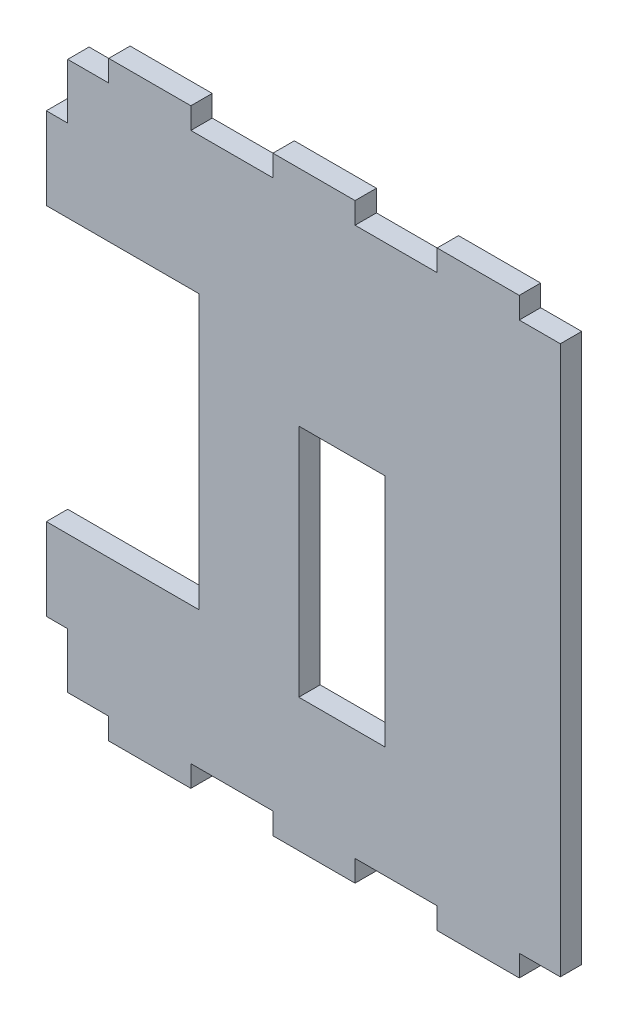
from build123d import *

# Parameters (mm, degrees)
SKETCH1_W           = 114.3
SKETCH1_H           = 127.2286
BOSS_EXTRUDE1_DEPTH = 2.48046875
SKETCH3_W           = 19.05
SKETCH3_H           = 4.9609375
BOSS_EXTRUDE2_DEPTH = 4.9609375
SKETCH5_W           = 19.05
SKETCH5_H           = 4.9609375
BOSS_EXTRUDE3_DEPTH = 4.9784
SKETCH7_W           = 4.9609375
SKETCH7_H           = 63.5
CUT_EXTRUDE1_DEPTH  = 30.48
SKETCH6_W           = 4.9609375
SKETCH6_H           = 19.05
BOSS_EXTRUDE4_DEPTH = 4.9609375
CAVITY1_START       = -3.0309375
CAVITY1_2_OUTLINE_W = 41
CAVITY1_2_OUTLINE_H = 4.9609375
CAVITY1_2_DEPTH     = 19
CAVITY1_START_2     = -2.3309375
CAVITY1_3_DEPTH     = 17.6
CAVITY1_START_3     = -3
CAVITY1_4_DEPTH     = 6
CAVITY1_START_4     = 0.91953125
CAVITY1_6_OUTLINE_R = 3
CAVITY1_6_DEPTH     = 1.5609375
SKETCH9_W           = 20
SKETCH9_H           = 54.483
CUT_EXTRUDE2_DEPTH  = 93.827315363


with BuildPart() as part:
    # Sketch1 → Boss-Extrude1 (new, symmetric)
    with BuildSketch(Plane.XY):
        Rectangle(SKETCH1_W, SKETCH1_H)
    extrude(amount=BOSS_EXTRUDE1_DEPTH, both=True)

    # Sketch3 → Boss-Extrude2 (add)
    with BuildSketch(Plane(origin=(0, 63.6143, 0), x_dir=(1, 0, 0), z_dir=(0, 1, 0))):
        with Locations((38.1, 0)):
            Rectangle(SKETCH3_W, SKETCH3_H)
        Rectangle(SKETCH3_W, SKETCH3_H)
        with Locations((-38.1, 0)):
            Rectangle(SKETCH3_W, SKETCH3_H)
    extrude(amount=BOSS_EXTRUDE2_DEPTH)

    # Sketch5 → Boss-Extrude3 (add)
    with BuildSketch(Plane.XZ.offset(63.6143)):
        Rectangle(SKETCH5_W, SKETCH5_H)
        with Locations((38.1, 0)):
            Rectangle(SKETCH5_W, SKETCH5_H)
        with Locations((-38.1, 0)):
            Rectangle(SKETCH5_W, SKETCH5_H)
    extrude(amount=BOSS_EXTRUDE3_DEPTH)

    # Sketch7 → Cut-Extrude1 (cut)
    with BuildSketch(Plane.ZY.offset(57.15)):
        Rectangle(SKETCH7_W, SKETCH7_H)
    extrude(amount=-CUT_EXTRUDE1_DEPTH, mode=Mode.SUBTRACT)

    # Sketch6 → Boss-Extrude4 (add)
    with BuildSketch(Plane.ZY.offset(57.15)):
        with Locations((0, 41.275)):
            Rectangle(SKETCH6_W, SKETCH6_H)
        with Locations((0, -41.275)):
            Rectangle(SKETCH6_W, SKETCH6_H)
    extrude(amount=BOSS_EXTRUDE4_DEPTH)

    # Cavity1: read off the stored shape, not the designer's step
    # Cavity1 outline → Cavity1 (revolve, cut)
    with BuildSketch(Plane(origin=(15.2690625, 0, -2.53046875), x_dir=(1, 0, 0), z_dir=(0, 0, 1))):
        with BuildLine():
            ThreePointArc((0.05, -31.0547625), (0.064644661, -31.019407161), (0.1, -31.0047625))
            Line((0.1, -31.0047625), (0.1, 9.9952375))
            ThreePointArc((0.1, 9.9952375), (0.064644661, 10.009882161), (0.05, 10.0452375))
            Line((0.05, 10.0452375), (0.05, -31.0547625))
        make_face()
    revolve(axis=Axis((15.2690625, 0, -2.53046875), (0, 1, 0)), mode=Mode.SUBTRACT)

    # Cavity1 2 outline → Cavity1 2 (cut)
    with BuildSketch(Plane.YZ.offset(CAVITY1_START)):
        with Locations((-10.5047625, 0)):
            Rectangle(CAVITY1_2_OUTLINE_W, CAVITY1_2_OUTLINE_H)
    extrude(amount=CAVITY1_2_DEPTH, mode=Mode.SUBTRACT)

    # Cavity1 3 outline → Cavity1 3 (cut)
    with BuildSketch(Plane.YZ.offset(CAVITY1_START_2)):
        with BuildLine():
            ThreePointArc((-31.0047625, -2.43046875), (-31.019407161, -2.465824089), (-31.0547625, -2.48046875))
            Line((-31.0547625, -2.48046875), (-31.0047625, -2.48046875))
            Line((-31.0047625, -2.48046875), (-31.0047625, -2.43046875))
        make_face()
        with BuildLine():
            Line((9.9952375, -2.43046875), (9.9952375, -2.48046875))
            Line((9.9952375, -2.48046875), (10.0452375, -2.48046875))
            ThreePointArc((10.0452375, -2.48046875), (10.009882161, -2.465824089), (9.9952375, -2.43046875))
        make_face()
    extrude(amount=CAVITY1_3_DEPTH, mode=Mode.SUBTRACT)

    # Cavity1 4 outline → Cavity1 4 (cut)
    with BuildSketch(Plane.XY.offset(CAVITY1_START_3)):
        with BuildLine():
            ThreePointArc((15.9690625, -31.0047625), (16.322615891, -30.858315891), (16.4690625, -30.5047625))
            Line((16.4690625, -30.5047625), (16.4690625, 9.4952375))
            ThreePointArc((16.4690625, 9.4952375), (16.322615891, 9.848790891), (15.9690625, 9.9952375))
            Line((15.9690625, 9.9952375), (15.9690625, -31.0047625))
        make_face()
        with BuildLine():
            ThreePointArc((-3.0309375, 9.9952375), (-3.384490891, 9.848790891), (-3.5309375, 9.4952375))
            Line((-3.5309375, 9.4952375), (-3.5309375, -30.5047625))
            ThreePointArc((-3.5309375, -30.5047625), (-3.384490891, -30.858315891), (-3.0309375, -31.0047625))
            Line((-3.0309375, -31.0047625), (-3.0309375, 9.9952375))
        make_face()
    extrude(amount=CAVITY1_4_DEPTH, mode=Mode.SUBTRACT)

    # Cavity1 5 outline → Cavity1 5 (revolve, cut)
    with BuildSketch(Plane(origin=(-2.3309375, 0, -2.53046875), x_dir=(1, 0, 0), z_dir=(0, 0, 1))):
        with BuildLine():
            ThreePointArc((0.05, -31.0547625), (0.064644661, -31.019407161), (0.1, -31.0047625))
            Line((0.1, -31.0047625), (0.05, -31.0047625))
            Line((0.05, -31.0047625), (0.05, -31.0547625))
        make_face()
        with BuildLine():
            Line((0.05, 9.9952375), (0.1, 9.9952375))
            ThreePointArc((0.1, 9.9952375), (0.064644661, 10.009882161), (0.05, 10.0452375))
            Line((0.05, 10.0452375), (0.05, 9.9952375))
        make_face()
    revolve(axis=Axis((-2.3309375, 0, -2.53046875), (0, 1, 0)), mode=Mode.SUBTRACT)


with BuildPart() as body_2:
    # Cavity1 6 outline → Cavity1 6 (new body)
    with BuildSketch(Plane.XY.offset(CAVITY1_START_4)):
        with Locations((6.4690625, -0.0047625)):
            Circle(CAVITY1_6_OUTLINE_R)
    extrude(amount=CAVITY1_6_DEPTH)


with BuildPart() as cut_extrude2_tool:
    # Sketch9 → Cut-Extrude2 (new, through all)
    with BuildSketch(Plane(origin=(0, 0, -4.88046875), x_dir=(-1, 0, 0), z_dir=(0, 0, -1))):
        with Locations((-6.4690625, -10.5047625)):
            Rectangle(SKETCH9_W, SKETCH9_H)
    extrude(amount=-CUT_EXTRUDE2_DEPTH)


with BuildPart() as part_1:
    add(part.part)

    # Cut-Extrude2: cut by cut_extrude2_tool
    add(cut_extrude2_tool.part, mode=Mode.SUBTRACT)


with BuildPart() as body_2_1:
    add(body_2.part)

    # Cut-Extrude2: cut by cut_extrude2_tool
    add(cut_extrude2_tool.part, mode=Mode.SUBTRACT)


solid = part_1.part
